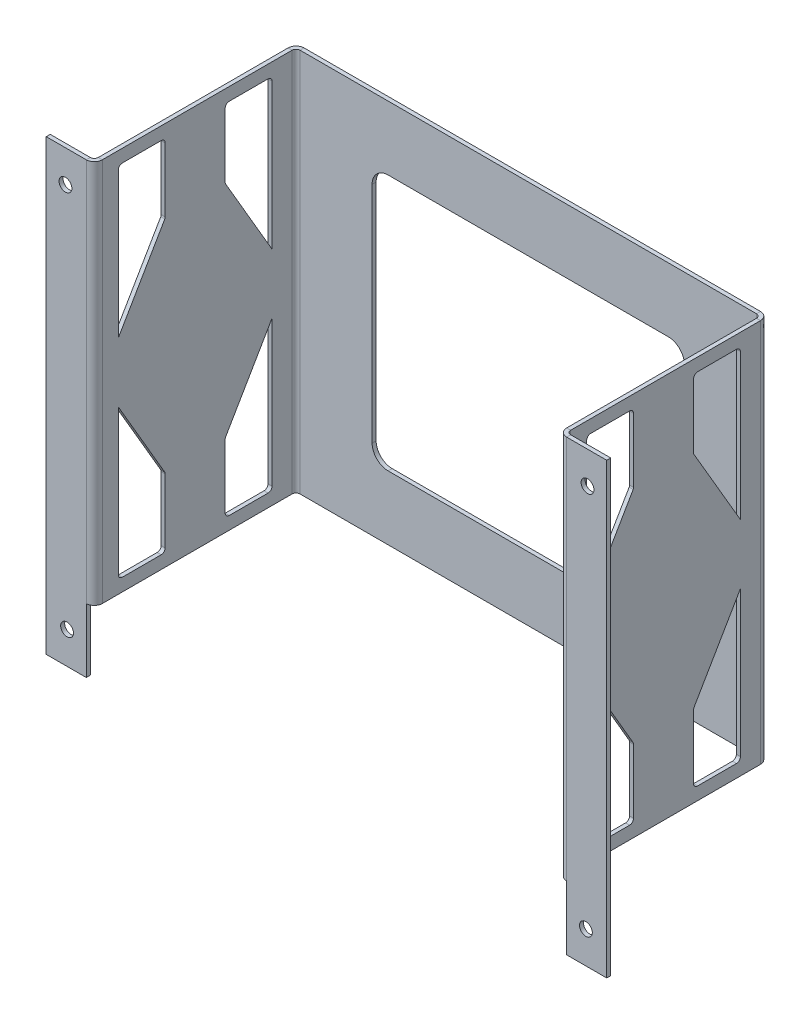
from build123d import *

# Parameters (mm, degrees)
BASE_FLANGE1_DEPTH  = 76.2
CUT_EXTRUDE1_DEPTH  = 1.5875
CUT_EXTRUDE4_DEPTH  = 223.428182145
SKETCH11_W          = 15.875
SKETCH11_H          = 1.5875
BOSS_EXTRUDE1_DEPTH = 25.4
SKETCH12_W          = 15.875
SKETCH12_H          = 1.5875
BOSS_EXTRUDE2_DEPTH = 25.4
SKETCH13_R          = 2.54
CUT_EXTRUDE5_DEPTH  = 25.4
SKETCH14_R          = 2.54
CUT_EXTRUDE6_DEPTH  = 25.4
SKETCH15_R          = 2.54
CUT_EXTRUDE7_DEPTH  = 25.4


# Sheet-metal steps are written as plain solids
with BuildPart() as part:
    # Sketch1 → Base-Flange1 (new, symmetric)
    with BuildSketch(Plane(origin=(0, 0, 0), x_dir=(1, 0, 0), z_dir=(0, 1, 0))):
        with BuildLine():
            Line((-111.125, -40.005), (-95.25, -40.005))
            ThreePointArc((-95.25, -40.005), (-93.00493597, -39.07506403), (-92.075, -36.83))
            Line((-92.075, -36.83), (-92.075, 38.4175))
            ThreePointArc((-92.075, 38.4175), (-91.610032015, 39.540032015), (-90.4875, 40.005))
            Line((-90.4875, 40.005), (90.4875, 40.005))
            ThreePointArc((90.4875, 40.005), (91.610032015, 39.540032015), (92.075, 38.4175))
            Line((92.075, 38.4175), (92.075, -36.83))
            ThreePointArc((92.075, -36.83), (93.00493597, -39.07506403), (95.25, -40.005))
            Line((95.25, -40.005), (111.125, -40.005))
            Line((111.125, -40.005), (111.125, -38.4175))
            Line((111.125, -38.4175), (95.25, -38.4175))
            ThreePointArc((95.25, -38.4175), (94.127467985, -37.952532015), (93.6625, -36.83))
            Line((93.6625, -36.83), (93.6625, 38.4175))
            ThreePointArc((93.6625, 38.4175), (92.73256403, 40.66256403), (90.4875, 41.5925))
            Line((90.4875, 41.5925), (-90.4875, 41.5925))
            ThreePointArc((-90.4875, 41.5925), (-92.73256403, 40.66256403), (-93.6625, 38.4175))
            Line((-93.6625, 38.4175), (-93.6625, -36.83))
            ThreePointArc((-93.6625, -36.83), (-94.127467985, -37.952532015), (-95.25, -38.4175))
            Line((-95.25, -38.4175), (-111.125, -38.4175))
            Line((-111.125, -38.4175), (-111.125, -40.005))
        make_face()
    extrude(amount=BASE_FLANGE1_DEPTH, both=True)

    # Sketch6 → Cut-Extrude1 (cut)
    with BuildSketch(Plane.XY.offset(-40.005)):
        with BuildLine():
            Line((-55.5625, -50.8), (55.5625, -50.8))
            ThreePointArc((55.5625, -50.8), (60.052628061, -48.940128061), (61.9125, -44.45))
            Line((61.9125, -44.45), (61.9125, 44.45))
            ThreePointArc((61.9125, 44.45), (60.052628061, 48.940128061), (55.5625, 50.8))
            Line((55.5625, 50.8), (-55.5625, 50.8))
            ThreePointArc((-55.5625, 50.8), (-60.052628061, 48.940128061), (-61.9125, 44.45))
            Line((-61.9125, 44.45), (-61.9125, -44.45))
            ThreePointArc((-61.9125, -44.45), (-60.052628061, -48.940128061), (-55.5625, -50.8))
        make_face()
    extrude(amount=-CUT_EXTRUDE1_DEPTH, mode=Mode.SUBTRACT)

    # Sketch10 → Cut-Extrude4 (cut, through all)
    with BuildSketch(Plane.ZY.offset(93.6625)):
        with BuildLine():
            Line((12.060895861, 43.449063634), (30.48, 11.848349253))
            Line((30.48, 11.848349253), (30.48, 69.5325))
            ThreePointArc((30.48, 69.5325), (30.015032015, 70.655032015), (28.8925, 71.12))
            Line((28.8925, 71.12), (13.49375, 71.12))
            ThreePointArc((13.49375, 71.12), (12.371217985, 70.655032015), (11.90625, 69.5325))
            Line((11.90625, 69.5325), (11.90625, 44.1325))
            ThreePointArc((11.90625, 44.1325), (11.945394066, 43.782142822), (12.060895861, 43.449063634))
        make_face()
        with BuildLine():
            Line((-13.49375, 71.12), (-28.8925, 71.12))
            ThreePointArc((-28.8925, 71.12), (-30.015032015, 70.655032015), (-30.48, 69.5325))
            Line((-30.48, 69.5325), (-30.48, 11.848349253))
            Line((-30.48, 11.848349253), (-12.060895861, 43.449063634))
            ThreePointArc((-12.060895861, 43.449063634), (-11.945394066, 43.782142822), (-11.90625, 44.1325))
            Line((-11.90625, 44.1325), (-11.90625, 69.5325))
            ThreePointArc((-11.90625, 69.5325), (-12.371217985, 70.655032015), (-13.49375, 71.12))
        make_face()
        with BuildLine():
            Line((30.48, -69.5325), (30.48, -11.848349253))
            Line((30.48, -11.848349253), (12.060895861, -43.449063634))
            ThreePointArc((12.060895861, -43.449063634), (11.945394066, -43.782142822), (11.90625, -44.1325))
            Line((11.90625, -44.1325), (11.90625, -69.5325))
            ThreePointArc((11.90625, -69.5325), (12.371217985, -70.655032015), (13.49375, -71.12))
            Line((13.49375, -71.12), (28.8925, -71.12))
            ThreePointArc((28.8925, -71.12), (30.015032015, -70.655032015), (30.48, -69.5325))
        make_face()
        with BuildLine():
            Line((-12.060895861, -43.449063634), (-30.48, -11.848349253))
            Line((-30.48, -11.848349253), (-30.48, -69.5325))
            ThreePointArc((-30.48, -69.5325), (-30.015032015, -70.655032015), (-28.8925, -71.12))
            Line((-28.8925, -71.12), (-13.49375, -71.12))
            ThreePointArc((-13.49375, -71.12), (-12.371217985, -70.655032015), (-11.90625, -69.5325))
            Line((-11.90625, -69.5325), (-11.90625, -44.1325))
            ThreePointArc((-11.90625, -44.1325), (-11.945394066, -43.782142822), (-12.060895861, -43.449063634))
        make_face()
    extrude(amount=-CUT_EXTRUDE4_DEPTH, mode=Mode.SUBTRACT)

    # Sketch11 → Boss-Extrude1 (add)
    with BuildSketch(Plane.XZ.offset(76.2)):
        with Locations((103.1875, 39.21125)):
            Rectangle(SKETCH11_W, SKETCH11_H)
    extrude(amount=BOSS_EXTRUDE1_DEPTH)

    # Sketch12 → Boss-Extrude2 (add)
    with BuildSketch(Plane(origin=(0, -76.2, 0), x_dir=(-1, 0, 0), z_dir=(0, -1, 0))):
        with Locations((103.1875, -39.21125)):
            Rectangle(SKETCH12_W, SKETCH12_H)
    extrude(amount=BOSS_EXTRUDE2_DEPTH)

    # Sketch13 → Cut-Extrude5 (cut)
    with BuildSketch(Plane(origin=(0, 0, 38.4175), x_dir=(-1, 0, 0), z_dir=(0, 0, -1))):
        with Locations((-102.87, -88.9)):
            Circle(SKETCH13_R)
        with Locations((-103.505, 63.5)):
            Circle(SKETCH13_R)
    extrude(amount=-CUT_EXTRUDE5_DEPTH, mode=Mode.SUBTRACT)

    # Sketch14 → Cut-Extrude6 (cut)
    with BuildSketch(Plane(origin=(0, 0, 38.4175), x_dir=(-1, 0, 0), z_dir=(0, 0, -1))):
        with Locations((103.505, 63.5)):
            Circle(SKETCH14_R)
    extrude(amount=-CUT_EXTRUDE6_DEPTH, mode=Mode.SUBTRACT)

    # Sketch15 → Cut-Extrude7 (cut)
    with BuildSketch(Plane(origin=(0, 0, 38.4175), x_dir=(-1, 0, 0), z_dir=(0, 0, -1))):
        with Locations((102.87, -88.9)):
            Circle(SKETCH15_R)
    extrude(amount=-CUT_EXTRUDE7_DEPTH, mode=Mode.SUBTRACT)


solid = part.part
